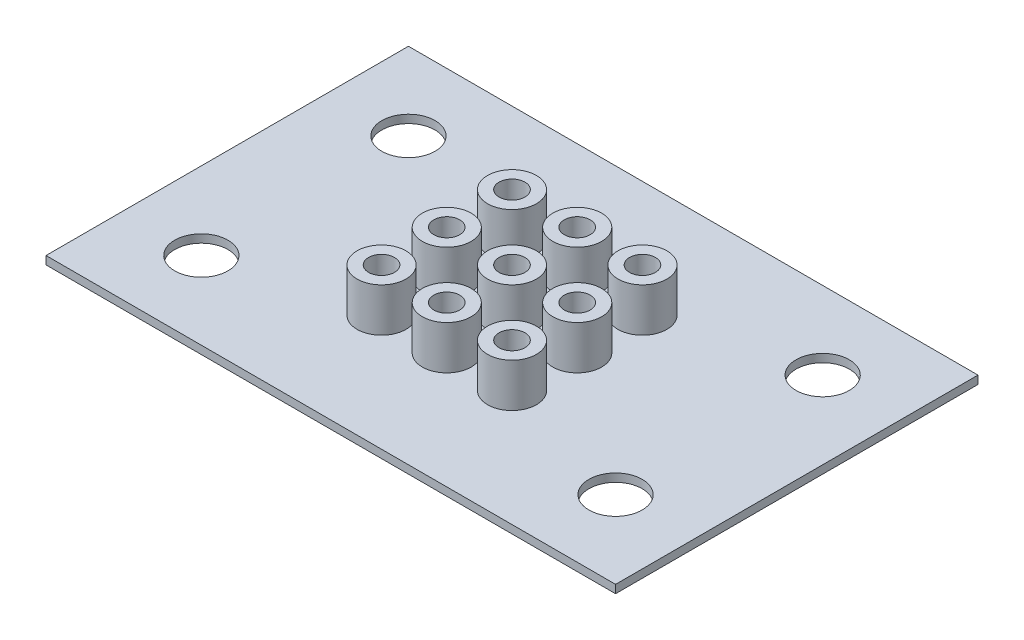
from build123d import *

# Parameters (mm, degrees)
SKETCH1_W           = 69.85
SKETCH1_H           = 44.45
SKETCH1_R           = 3.2639
SKETCH1_R_2         = 1.25
BOSS_EXTRUDE1_DEPTH = 1
SKETCH2_R           = 3
SKETCH2_R_2         = 1.59
BOSS_EXTRUDE2_DEPTH = 5.35


with BuildPart() as part:
    # Sketch1 → Boss-Extrude1 (new body)
    with BuildSketch(Plane(origin=(0, 0, 0), x_dir=(1, 0, 0), z_dir=(0, 1, 0))):
        with Locations((34.925, 22.225)):
            Rectangle(SKETCH1_W, SKETCH1_H)
        with Locations((9.525, 9.525)):
            Circle(SKETCH1_R, mode=Mode.SUBTRACT)
        with Locations((26.925, 14.225)):
            Circle(SKETCH1_R_2, mode=Mode.SUBTRACT)
        with Locations((26.925, 22.225)):
            Circle(SKETCH1_R_2, mode=Mode.SUBTRACT)
        with Locations((60.325, 9.525)):
            Circle(SKETCH1_R, mode=Mode.SUBTRACT)
        with Locations((34.925, 14.225)):
            Circle(SKETCH1_R_2, mode=Mode.SUBTRACT)
        with Locations((42.925, 14.225)):
            Circle(SKETCH1_R_2, mode=Mode.SUBTRACT)
        with Locations((26.925, 30.225)):
            Circle(SKETCH1_R_2, mode=Mode.SUBTRACT)
        with Locations((34.925, 30.225)):
            Circle(SKETCH1_R_2, mode=Mode.SUBTRACT)
        with Locations((9.525, 34.925)):
            Circle(SKETCH1_R, mode=Mode.SUBTRACT)
        with Locations((34.925, 22.225)):
            Circle(SKETCH1_R_2, mode=Mode.SUBTRACT)
        with Locations((42.925, 22.225)):
            Circle(SKETCH1_R_2, mode=Mode.SUBTRACT)
        with Locations((42.925, 30.225)):
            Circle(SKETCH1_R_2, mode=Mode.SUBTRACT)
        with Locations((60.325, 34.925)):
            Circle(SKETCH1_R, mode=Mode.SUBTRACT)
    extrude(amount=BOSS_EXTRUDE1_DEPTH)

    # Sketch2 → Boss-Extrude2 (add)
    # profile 1 of 9: a face of its own
    with BuildSketch(Plane(origin=(0, 1, 0), x_dir=(1, 0, 0), z_dir=(0, 1, 0))):
        with Locations((34.925, 22.225)):
            Circle(SKETCH2_R)
        with Locations((34.925, 22.225)):
            Circle(SKETCH2_R_2, mode=Mode.SUBTRACT)
    # profile 2 of 9: a face of its own
    with BuildSketch(Plane(origin=(0, 1, 0), x_dir=(1, 0, 0), z_dir=(0, 1, 0))):
        with Locations((42.925, 22.225)):
            Circle(SKETCH2_R)
        with Locations((42.925, 22.225)):
            Circle(SKETCH2_R_2, mode=Mode.SUBTRACT)
    # profile 3 of 9: a face of its own
    with BuildSketch(Plane(origin=(0, 1, 0), x_dir=(1, 0, 0), z_dir=(0, 1, 0))):
        with Locations((42.925, 30.225)):
            Circle(SKETCH2_R)
        with Locations((42.925, 30.225)):
            Circle(SKETCH2_R_2, mode=Mode.SUBTRACT)
    # profile 4 of 9: a face of its own
    with BuildSketch(Plane(origin=(0, 1, 0), x_dir=(1, 0, 0), z_dir=(0, 1, 0))):
        with Locations((34.925, 30.225)):
            Circle(SKETCH2_R)
        with Locations((34.925, 30.225)):
            Circle(SKETCH2_R_2, mode=Mode.SUBTRACT)
    # profile 5 of 9: a face of its own
    with BuildSketch(Plane(origin=(0, 1, 0), x_dir=(1, 0, 0), z_dir=(0, 1, 0))):
        with Locations((42.925, 14.225)):
            Circle(SKETCH2_R)
        with Locations((42.925, 14.225)):
            Circle(SKETCH2_R_2, mode=Mode.SUBTRACT)
    # profile 6 of 9: a face of its own
    with BuildSketch(Plane(origin=(0, 1, 0), x_dir=(1, 0, 0), z_dir=(0, 1, 0))):
        with Locations((34.925, 14.225)):
            Circle(SKETCH2_R)
        with Locations((34.925, 14.225)):
            Circle(SKETCH2_R_2, mode=Mode.SUBTRACT)
    # profile 7 of 9: a face of its own
    with BuildSketch(Plane(origin=(0, 1, 0), x_dir=(1, 0, 0), z_dir=(0, 1, 0))):
        with Locations((26.925, 22.225)):
            Circle(SKETCH2_R)
        with Locations((26.925, 22.225)):
            Circle(SKETCH2_R_2, mode=Mode.SUBTRACT)
    # profile 8 of 9: a face of its own
    with BuildSketch(Plane(origin=(0, 1, 0), x_dir=(1, 0, 0), z_dir=(0, 1, 0))):
        with Locations((26.925, 30.225)):
            Circle(SKETCH2_R)
        with Locations((26.925, 30.225)):
            Circle(SKETCH2_R_2, mode=Mode.SUBTRACT)
    # profile 9 of 9: a face of its own
    with BuildSketch(Plane(origin=(0, 1, 0), x_dir=(1, 0, 0), z_dir=(0, 1, 0))):
        with Locations((26.925, 14.225)):
            Circle(SKETCH2_R)
        with Locations((26.925, 14.225)):
            Circle(SKETCH2_R_2, mode=Mode.SUBTRACT)
    extrude(amount=BOSS_EXTRUDE2_DEPTH)


solid = part.part
